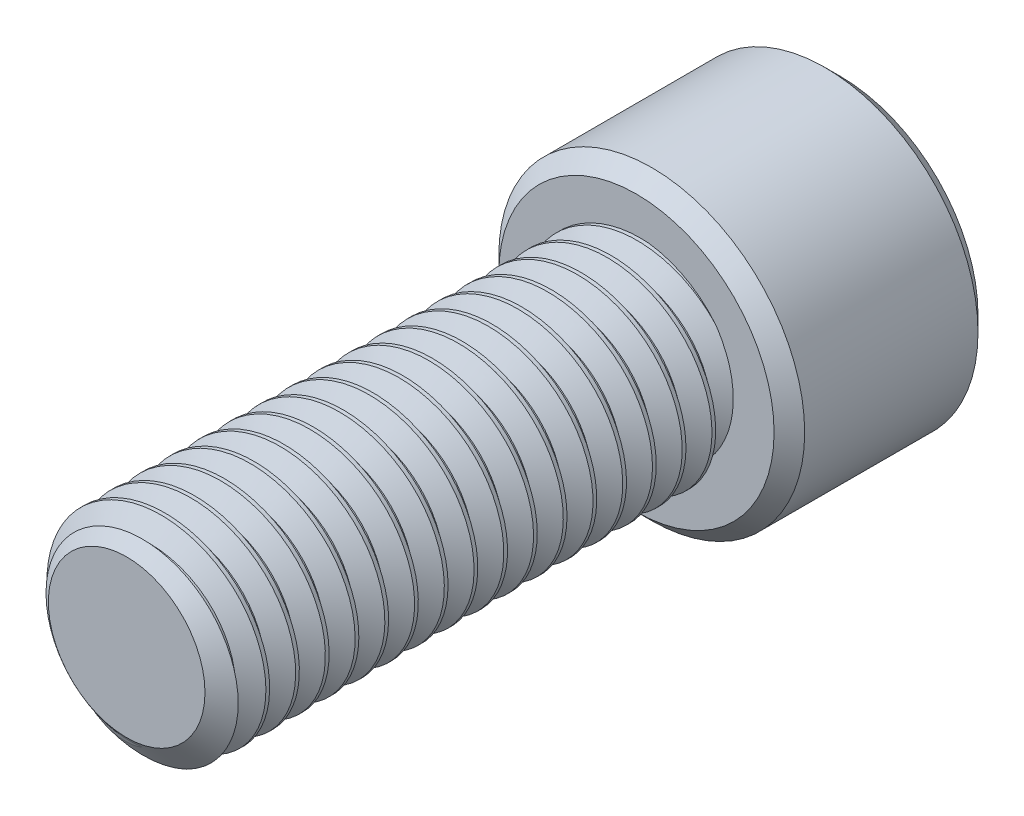
from build123d import *

# Parameters (mm, degrees)
SKETCH1_R          = 6
EXTRUDE1_DEPTH     = 30
CUT_SWEEP1_PITCH   = 1.75
SKETCH6_R          = 9
EXTRUDE2_DEPTH     = 12
CUT_EXTRUDE1_DEPTH = 7.5
CHAMFER1_SIZE      = 0.9


with BuildPart() as part:
    # Sketch1 → Extrude1 (new body)
    with BuildSketch(Plane.XY):
        Circle(SKETCH1_R)
    extrude(amount=-EXTRUDE1_DEPTH)

    # Cut-Sweep1: the profile of Sketch3 profile screwed along a right-hand helix of 18.142857 turns, 6 arcs to a turn; built about Z, then put on its axis
    cut_sweep1_z = Axis((0, 0, 0), (0, 0, 1))
    cut_sweep1_corners = [(6.0003, 0, -1.531423205), (4.863341658, 0, -0.875), (4.863341658, 0, -0.65625), (6.0003, 0, 0.000173205)]
    with BuildLine(mode=Mode.PRIVATE) as cut_sweep1_profile:
        Line(cut_sweep1_corners[0], cut_sweep1_corners[1])
        Line(cut_sweep1_corners[1], cut_sweep1_corners[2])
        Line(cut_sweep1_corners[2], cut_sweep1_corners[3])
        Line(cut_sweep1_corners[3], cut_sweep1_corners[0])
    cut_sweep1_cap = Face(cut_sweep1_profile.wire())
    cut_sweep1_turn_angles = [0, 30, 60, 90, 120, 150, 180, 210, 240, 270, 300, 330, 360]
    cut_sweep1_turn_weights = [1, 0.8660254037844387, 1, 0.8660254037844387, 1, 0.8660254037844387, 1, 0.8660254037844387, 1, 0.8660254037844387, 1, 0.8660254037844387, 1]
    cut_sweep1_turn_rails = [Edge.make_bspline([Vector(p[0], p[1], 0).rotate(cut_sweep1_z, cut_sweep1_turn_angles[k]) / cut_sweep1_turn_weights[k] + Vector(0, 0, p[2] + CUT_SWEEP1_PITCH * cut_sweep1_turn_angles[k] / 360) for k in range(13)], [0, 0, 0, 1, 1, 2, 2, 3, 3, 4, 4, 5, 5, 6, 6, 6], 2, cut_sweep1_turn_weights) for p in cut_sweep1_corners]
    cut_sweep1_turn_sides = [Face.make_surface_from_curves(cut_sweep1_turn_rails[p[0]], cut_sweep1_turn_rails[p[1]]) for p in [(0, 1), (1, 2), (2, 3), (3, 0)]]
    cut_sweep1_last_angles = [6480, 6505.714285714, 6531.428571429]
    cut_sweep1_last_weights = [1, 0.9009688679025151, 1]
    cut_sweep1_last_rails = [Edge.make_bspline([Vector(p[0], p[1], 0).rotate(cut_sweep1_z, cut_sweep1_last_angles[k]) / cut_sweep1_last_weights[k] + Vector(0, 0, p[2] + CUT_SWEEP1_PITCH * cut_sweep1_last_angles[k] / 360) for k in range(3)], [0, 0, 0, 1, 1, 1], 2, cut_sweep1_last_weights) for p in cut_sweep1_corners]
    cut_sweep1_last_sides = [Face.make_surface_from_curves(cut_sweep1_last_rails[p[0]], cut_sweep1_last_rails[p[1]]) for p in [(0, 1), (1, 2), (2, 3), (3, 0)]]
    cut_sweep1 = Plane(origin=(0, 0, 0), x_dir=(0, 1, 0), z_dir=(0, 0, -1)) * Solid(Shell([*[p.moved(Location((0, 0, CUT_SWEEP1_PITCH * i))) for i in range(18) for p in cut_sweep1_turn_sides], *cut_sweep1_last_sides, cut_sweep1_cap, cut_sweep1_cap.rotate(cut_sweep1_z, 6531.428571429).moved(Location((0, 0, CUT_SWEEP1_PITCH * 6531.428571429 / 360)))]))
    add(cut_sweep1, mode=Mode.SUBTRACT)

    # Sketch4 → Cut-Revolve1 (revolve, cut)
    with BuildSketch(Plane(origin=(0, 0, 0), x_dir=(0, 0, -1), z_dir=(1, 0, 0)), mode=Mode.PRIVATE) as cut_revolve1_sk:
        Polygon((0.973749454, 6), (0, 4.609341658), (0, 6), align=None)
    revolve(cut_revolve1_sk.sketch.rotate(Axis((0, 0, 0), (0, 0, -1)), 216.302676127), axis=Axis((0, 0, 0), (0, 0, -1)), mode=Mode.SUBTRACT)

    # Sketch6 → Extrude2 (add)
    with BuildSketch(Plane(origin=(0, 0, -30), x_dir=(-1, 0, 0), z_dir=(0, 0, -1))):
        with Locations(Location((0, 0, 0), (0, 0, 180))):
            Circle(SKETCH6_R)
    extrude(amount=EXTRUDE2_DEPTH)

    # Sketch7 → Cut-Extrude1 (cut)
    with BuildSketch(Plane(origin=(0, 0, -42), x_dir=(-1, 0, 0), z_dir=(0, 0, -1))):
        Polygon((0, 5.773502692), (-5, 2.886751346), (-5, -2.886751346), (0, -5.773502692), (5, -2.886751346), (5, 2.886751346), align=None)
    extrude(amount=-CUT_EXTRUDE1_DEPTH, mode=Mode.SUBTRACT)

    # Cut-Extrude2 cone 1 section (through the dimple's axis) → Cut-Extrude2 (revolve, cut)
    with BuildSketch(Plane(origin=(0, 0, -42), x_dir=(0, 1, 0), z_dir=(1, 0, 0))):
        Polygon((0, 0), (5.773502692, 0), (0, 5.773502692), align=None)
    revolve(axis=Axis((0, 0, -42), (0, 0, 1)), mode=Mode.SUBTRACT)

    # Chamfer1
    chamfer1_edges = [part.edges().sort_by_distance(p)[0] for p in [
        (-9, 0, -30),
        (-9, 0, -42),
    ]]
    chamfer(chamfer1_edges, length=CHAMFER1_SIZE)


solid = part.part
